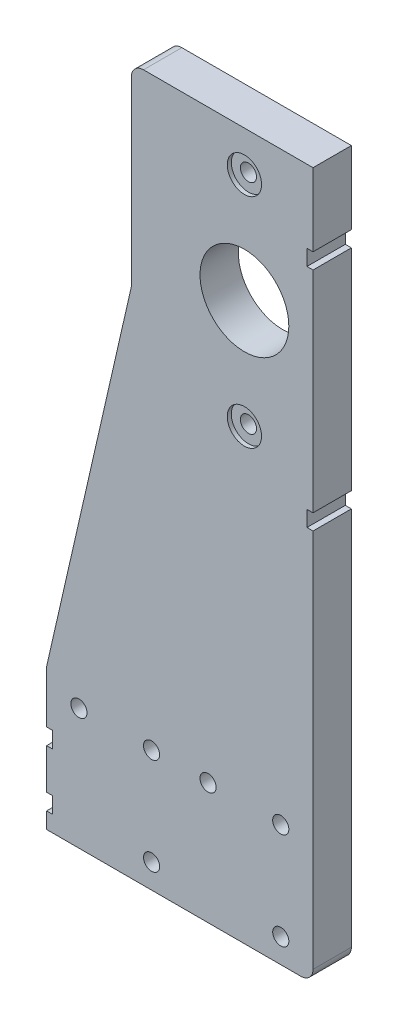
from build123d import *

# Parameters (mm, degrees)
EXTRUDE_4_DEPTH      = 9.5
SKETCH_11_R          = 2
CUT_EXTRUDE_8_DEPTH  = 188.27319616
SKETCH_12_R          = 4.25
CUT_EXTRUDE_9_DEPTH  = 1
FILLET_7_R           = 3
SKETCH_19_R          = 11
CUT_EXTRUDE_11_DEPTH = 188.27319616
SKETCH_21_W          = 9.5
SKETCH_21_H          = 4
CUT_EXTRUDE_12_DEPTH = 1.5
SKETCH_22_W          = 9.5
SKETCH_22_H          = 3.9
CUT_EXTRUDE_13_DEPTH = 1.5
SKETCH_26_R          = 4
CUT_EXTRUDE_18_DEPTH = 4
SKETCH_27_R          = 2
CUT_EXTRUDE_19_DEPTH = 188.27319616
SKETCH_28_R          = 4
CUT_EXTRUDE_20_DEPTH = 4


with BuildPart() as part:
    # 草图10 → 凸台-拉伸4 (new body)
    with BuildSketch(Plane.XY):
        Polygon((0, 0), (66, 0), (66, 175), (21, 175), (21, 127), (0, 35), align=None)
    extrude(amount=EXTRUDE_4_DEPTH)

    # 草图11 → 切除-拉伸8 (cut, through all)
    with BuildSketch(Plane.XY.offset(9.5)):
        with Locations((49, 165)):
            Circle(SKETCH_11_R)
        with Locations((49, 111)):
            Circle(SKETCH_11_R)
    extrude(amount=-CUT_EXTRUDE_8_DEPTH, mode=Mode.SUBTRACT)

    # 草图12 → 切除-拉伸9 (cut)
    with BuildSketch(Plane.XY.offset(9.5)):
        with Locations((49, 165)):
            Circle(SKETCH_12_R)
        with Locations((49, 111)):
            Circle(SKETCH_12_R)
    extrude(amount=-CUT_EXTRUDE_9_DEPTH, mode=Mode.SUBTRACT)

    # 圆角7
    fillet_7_edges = [part.edges().sort_by_distance(p)[0] for p in [
        (66, 0, 4.75),
        (21, 127, 4.75),
        (21, 175, 4.75),
    ]]
    fillet(fillet_7_edges, radius=FILLET_7_R)

    # 草图19 → 切除-拉伸11 (cut, through all)
    with BuildSketch(Plane.XY.offset(9.5)):
        with Locations((49, 138)):
            Circle(SKETCH_19_R)
    extrude(amount=-CUT_EXTRUDE_11_DEPTH, mode=Mode.SUBTRACT)

    # 草图21 → 切除-拉伸12 (cut)
    with BuildSketch(Plane.ZY):
        with Locations((4.75, 6)):
            Rectangle(SKETCH_21_W, SKETCH_21_H)
        with Locations((4.75, 20)):
            Rectangle(SKETCH_21_W, SKETCH_21_H)
    extrude(amount=-CUT_EXTRUDE_12_DEPTH, mode=Mode.SUBTRACT)

    # 草图22 → 切除-拉伸13 (cut)
    with BuildSketch(Plane(origin=(66, 0, 0), x_dir=(0, 0, -1), z_dir=(1, 0, 0))):
        with Locations((-4.75, 99)):
            Rectangle(SKETCH_22_W, SKETCH_22_H)
        with Locations((-4.75, 154.999999999)):
            Rectangle(SKETCH_22_W, SKETCH_22_H)
    extrude(amount=-CUT_EXTRUDE_13_DEPTH, mode=Mode.SUBTRACT)

    # 草图26 → 切除-拉伸18 (cut)
    with BuildSketch(Plane(origin=(0, 0, 0), x_dir=(-1, 0, 0), z_dir=(0, 0, -1))):
        with Locations((-49, 165)):
            Circle(SKETCH_26_R)
        with Locations((-49, 111)):
            Circle(SKETCH_26_R)
    extrude(amount=-CUT_EXTRUDE_18_DEPTH, mode=Mode.SUBTRACT)

    # 草图27 → 切除-拉伸19 (cut, through all)
    with BuildSketch(Plane.XY.offset(9.5)):
        with Locations((8, 30.03)):
            Circle(SKETCH_27_R)
        with Locations((26, 30.03)):
            Circle(SKETCH_27_R)
        with Locations((40, 30.03)):
            Circle(SKETCH_27_R)
        with Locations((58, 30.03)):
            Circle(SKETCH_27_R)
        with Locations((58, 6.03)):
            Circle(SKETCH_27_R)
        with Locations((26, 6.03)):
            Circle(SKETCH_27_R)
    extrude(amount=-CUT_EXTRUDE_19_DEPTH, mode=Mode.SUBTRACT)

    # 草图28 → 切除-拉伸20 (cut)
    with BuildSketch(Plane(origin=(0, 0, 0), x_dir=(-1, 0, 0), z_dir=(0, 0, -1))):
        with Locations((-58, 30.03)):
            Circle(SKETCH_28_R)
        with Locations((-40, 30.03)):
            Circle(SKETCH_28_R)
        with Locations((-26, 30.03)):
            Circle(SKETCH_28_R)
        with Locations((-8, 30.03)):
            Circle(SKETCH_28_R)
        with Locations((-58, 6.03)):
            Circle(SKETCH_28_R)
        with Locations((-26, 6.03)):
            Circle(SKETCH_28_R)
    extrude(amount=-CUT_EXTRUDE_20_DEPTH, mode=Mode.SUBTRACT)


solid = part.part
